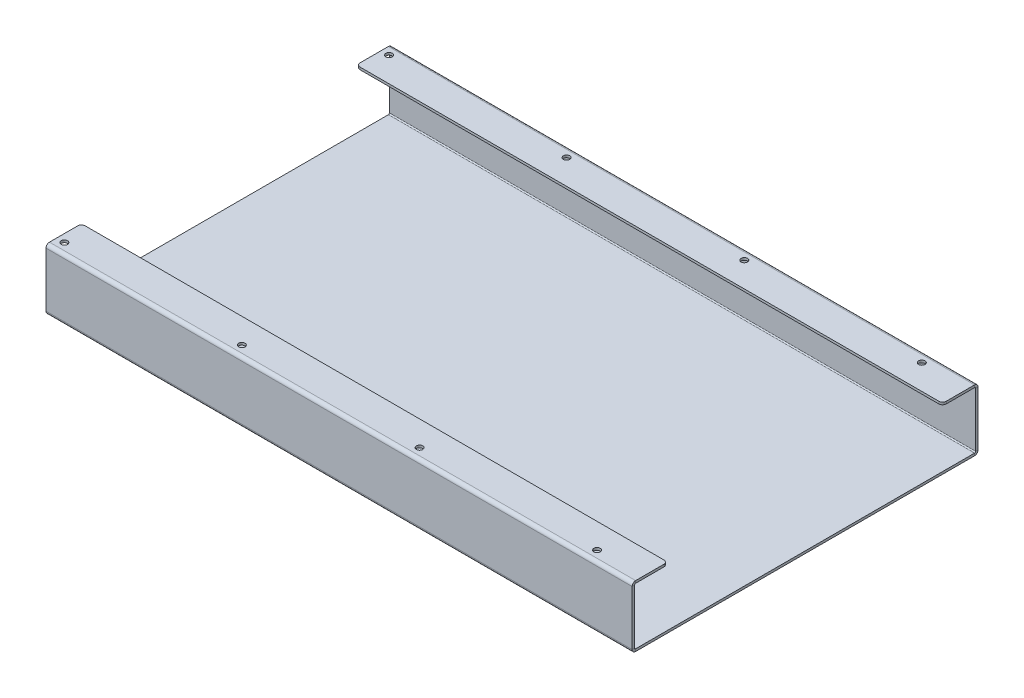
from build123d import *

# Parameters (mm, degrees)
SKETCH1_W                 = 393.7
SKETCH1_H                 = 229.108
BASE_FLANGE1_DEPTH        = 1.5875
MITER_START               = -196.85
MITER_FLANGE1_DEPTH       = 393.7
MITER_FLANGE1_2_DEPTH     = 393.7
F_8_CLEARANCE_HOLE1_D     = 4.3053
F_8_CLEARANCE_HOLE1_DEPTH = 1.5875
FILLET1_R                 = 2.54


# Read off the part's stored shape, not the designer's step: Miter Flange1
# Sheet-metal steps are written as plain solids
with BuildPart() as part:
    # Sketch1 → Base-Flange1 (new body)
    with BuildSketch(Plane(origin=(0, 0, 0), x_dir=(1, 0, 0), z_dir=(0, 1, 0))):
        Rectangle(SKETCH1_W, SKETCH1_H)
    extrude(amount=-BASE_FLANGE1_DEPTH)

    # Miter Flange1 outline → Miter Flange1 (cut)
    with BuildSketch(Plane.YZ.offset(MITER_START)):
        with BuildLine():
            Line((-1.5875, -114.554), (-1.467682479, -114.554))
            ThreePointArc((-1.467682479, -114.554), (-1.557350056, -114.190540657), (-1.5875, -113.8174))
            Line((-1.5875, -113.8174), (-1.5875, -114.554))
        make_face()
    miter_flange1 = extrude(amount=MITER_FLANGE1_DEPTH, mode=Mode.SUBTRACT)

    # Miter Flange1 2 outline → Miter Flange1 2 (add)
    with BuildSketch(Plane.YZ.offset(MITER_START)):
        with BuildLine():
            Line((39.6875, -113.8174), (39.6875, -92.329))
            Line((39.6875, -92.329), (38.1, -92.329))
            Line((38.1, -92.329), (38.1, -113.8174))
            ThreePointArc((38.1, -113.8174), (37.884254855, -114.338254855), (37.3634, -114.554))
            Line((37.3634, -114.554), (0.7366, -114.554))
            ThreePointArc((0.7366, -114.554), (0.215745145, -114.338254855), (0, -113.8174))
            Line((0, -113.8174), (0, -114.554))
            Line((0, -114.554), (-1.467682479, -114.554))
            ThreePointArc((-1.467682479, -114.554), (-0.621617352, -115.703317929), (0.7366, -116.1415))
            Line((0.7366, -116.1415), (37.3634, -116.1415))
            ThreePointArc((37.3634, -116.1415), (39.00678687, -115.46078687), (39.6875, -113.8174))
        make_face()
    miter_flange1_2 = extrude(amount=MITER_FLANGE1_2_DEPTH)

    # Mirror1: Miter Flange1, Miter Flange1 2 across plane
    add(miter_flange1.mirror(Plane.XY), mode=Mode.SUBTRACT)
    add(miter_flange1_2.mirror(Plane.XY))

    # #8 Clearance Hole1
    with Locations(Plane(origin=(0, 39.6875, 0), x_dir=(1, 0, 0), z_dir=(0, 1, 0))):
        with Locations((166.207772673, -109.057772673), (46.99, -109.057772673), (-72.39, -109.057772673), (-191.607772673, -109.057772673), (-191.607772673, 109.057772673), (-72.39, 109.057772673), (46.99, 109.057772673), (166.207772673, 109.057772673)):
            Hole(F_8_CLEARANCE_HOLE1_D / 2, depth=F_8_CLEARANCE_HOLE1_DEPTH)

    # Fillet1
    fillet1_edges = [part.edges().sort_by_distance(p)[0] for p in [
        (-196.85, 38.89375, -92.329),
        (196.85, 38.89375, -92.329),
        (-196.85, 38.89375, 92.329),
        (196.85, 38.89375, 92.329),
    ]]
    fillet(fillet1_edges, radius=FILLET1_R)


solid = part.part
